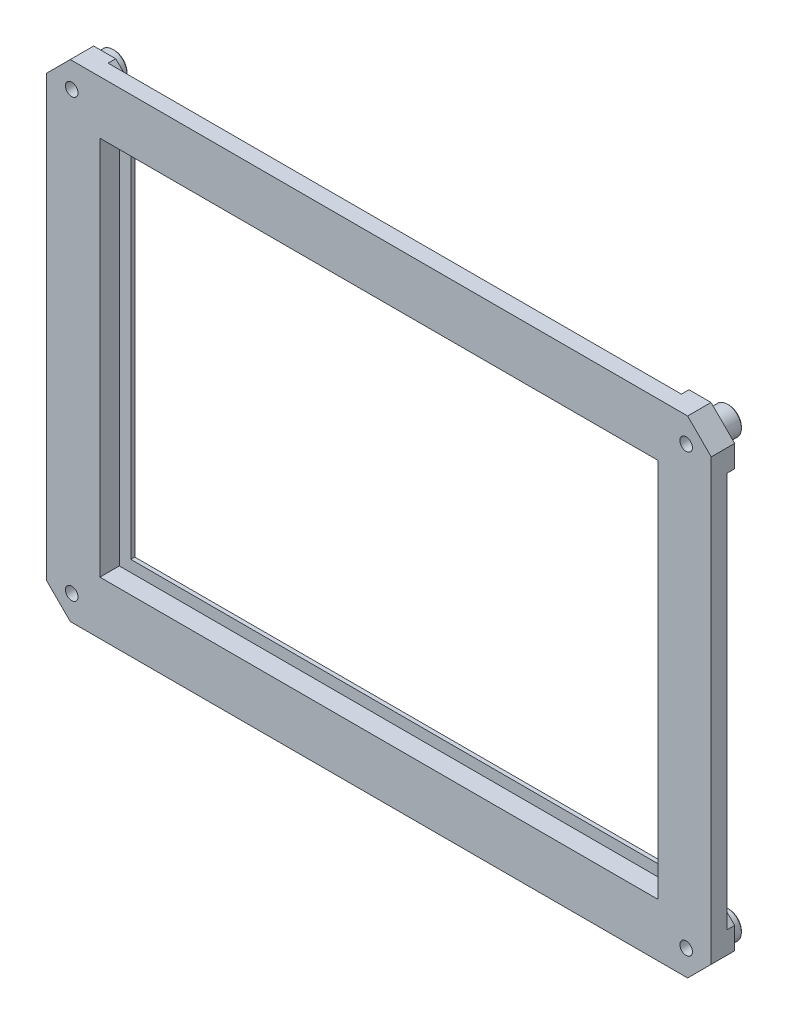
from build123d import *
from build123d.topology import SkipClean

# Parameters (mm, degrees)
BOSS_EXTRUDE1_DEPTH                      = 3
BOSS_EXTRUDE1_2_DEPTH                    = 3
BOSS_EXTRUDE1_3_DEPTH                    = 3
BOSS_EXTRUDE1_4_DEPTH                    = 3
BOSS_EXTRUDE1_5_DEPTH                    = 3
BOSS_EXTRUDE2_DEPTH                      = 6.15
CHAMFER1_SIZE                            = 2
BOSS_EXTRUDE3_DEPTH                      = 3
MIRROR1_DEPTH                            = 2
CHAMFER2_SIZE                            = 2
CUT_EXTRUDE2_DEPTH                       = 5.1
BOSS_EXTRUDE4_DEPTH                      = 5
CUT_EXTRUDE4_DEPTH                       = 202.98709309422546
MIRROR3_AT_THE_SECOND_PLANE_COPY_1_DEPTH = 5
MIRROR3_AT_THE_SECOND_PLANE_COPY_2_DEPTH = 202.98709309422546
CHAMFER3_SIZE                            = 0.3
CUT_EXTRUDE3_REACH                       = 210.139
BOSS_EXTRUDE5_DEPTH                      = 2.9


# Read off the part's stored shape, not the designer's step: Mirror1
with BuildPart() as part:
    # Sketch1 → Boss-Extrude1 (new body)
    with BuildSketch(Plane.XY):
        Polygon((-156.55, 3.799999999998499), (-156.55000000000007, 103.39999999999857), (-157.60000000000005, 103.39999999999857), (-157.60000000000002, 3.799999999998499), align=None)
    extrude(amount=-BOSS_EXTRUDE1_DEPTH)



with BuildPart() as body_2:
    # Sketch1 → Boss-Extrude1 2 (new body)
    with BuildSketch(Plane.XY):
        Polygon((-150.1, 109.84999999999852), (-3.800000000000109, 109.84999999999862), (-3.800000000000109, 110.89999999999861), (-150.10000000000008, 110.8999999999985), align=None)
    extrude(amount=-BOSS_EXTRUDE1_2_DEPTH)


with BuildPart() as body_3:
    # Sketch1 → Boss-Extrude1 3 (new body)
    with BuildSketch(Plane.XY):
        Polygon((2.6499999999999164, 103.39999999999867), (2.649999999999972, 3.7999999999985548), (3.6999999999999673, 3.7999999999985477), (3.6999999999999256, 103.39999999999867), align=None)
    extrude(amount=-BOSS_EXTRUDE1_3_DEPTH)


with BuildPart() as body_4:
    # Sketch1 → Boss-Extrude1 4 (new body)
    with BuildSketch(Plane.XY):
        Polygon((-3.800000000000109, -2.6500000000013597), (-150.09999999999997, -2.650000000001457), (-150.09999999999997, -3.700000000001438), (-3.8000000000000393, -3.7000000000013826), align=None)
    extrude(amount=-BOSS_EXTRUDE1_4_DEPTH)


with BuildPart() as body_5:
    # Sketch1 → Boss-Extrude1 5 (new body)
    with BuildSketch(Plane.XY):
        Polygon((-151.25, 2.6499999999985424), (-2.6500000000000274, 2.6499999999986117), (-2.650000000000083, 104.54999999999862), (-151.25000000000006, 104.54999999999853), align=None)
        Polygon((-150.20000000000005, 103.49999999999854), (-3.7000000000000783, 103.49999999999862), (-3.700000000000023, 3.699999999998614), (-150.2, 3.699999999998545), align=None, mode=Mode.SUBTRACT)
    extrude(amount=-BOSS_EXTRUDE1_5_DEPTH)


with BuildPart() as part_1:
    add(part.part)

    add(body_2.part)  # Boss-Extrude2 merges body 2

    add(body_3.part)  # Boss-Extrude2 merges body 3

    add(body_4.part)  # Boss-Extrude2 merges body 4

    add(body_5.part)  # Boss-Extrude2 merges body 5
    # Sketch2 → Boss-Extrude2 (add)
    with BuildSketch(Plane.XY):
        Polygon((-152.20000000000053, -10.287704918043708), (-157.98770491803333, -10.287704918043712), (-164.18770491803335, -4.087704918043719), (-164.18770491803335, 1.699999999989038), (-164.18770491803284, 105.49999999999856), (-164.18770491803284, 111.28770491803135), (-157.98770491803285, 117.48770491803134), (-152.20000000000007, 117.48770491803134), (-1.700000000000101, 117.48770491803131), (4.087704918032683, 117.48770491803131), (10.287704918032786, 111.28770491801959), (10.287704918032786, 105.49999999998684), (10.287704918032786, 1.6999999999890605), (10.287704918032786, -4.087704918043723), (4.087704918032788, -10.28770491804372), (-1.6999999999999682, -10.28770491804372), align=None)
        Polygon((-147.2, 6.699999999998546), (-6.700000000000024, 6.699999999998613), (-6.700000000000077, 100.49999999999862), (-147.20000000000005, 100.49999999999854), align=None, mode=Mode.SUBTRACT)
    extrude(amount=BOSS_EXTRUDE2_DEPTH)

    # Chamfer1
    chamfer1_edges = [part_1.edges().sort_by_distance(p)[0] for p in [
        (7.187704918032787, -7.187704918043722, 0),
        (10.287704918032786, 53.59999999998793, 0),
        (7.187704918032734, 114.38770491802545, 0),
        (-76.95000000000007, 117.48770491803133, 0),
        (-161.08770491803284, 114.38770491803135, 0),
        (-164.1877049180331, 53.59999999999382, 0),
        (-161.08770491803335, -7.187704918043716, 0),
        (-76.95000000000027, -10.287704918043715, 0),
    ]]
    chamfer(chamfer1_edges, length=CHAMFER1_SIZE)

    # Sketch4 → Boss-Extrude3 (add)
    with BuildSketch(Plane(origin=(0, 0, 0), x_dir=(-1, 0, 0), z_dir=(0, 0, -1))):
        Polygon((1.7000000000001219, 1.6999999999889326), (-10.287704918032786, 1.699999999988929), (-10.287704918032786, -4.087704918043727), (-4.087704918032788, -10.28770491804372), (1.7000000000001094, -10.28770491804372), align=None)
        Polygon((164.18770491803335, -4.087704918043719), (164.18770491803332, 1.6999999999889503), (152.20000000000041, 1.6999999999889481), (152.20000000000007, -10.287704918043712), (157.98770491803333, -10.287704918043712), align=None)
        Polygon((157.98770491803285, 117.48770491803134), (152.20000000000033, 117.48770491803134), (152.20000000000002, 105.4999999999988), (164.18770491803286, 105.4999999999988), (164.18770491803284, 111.28770491803135), align=None)
        Polygon((1.7000000000001085, 105.49999999999868), (1.7000000000001094, 117.48770491803131), (-4.087704918032671, 117.48770491803131), (-10.287704918032784, 111.28770491801959), (-10.287704918032786, 105.49999999999868), align=None)
    extrude(amount=-BOSS_EXTRUDE3_DEPTH)

    # Sketch5 → Loft1 section 0
    with BuildSketch(Plane(origin=(0, 0, 0), x_dir=(-1, 0, 0), z_dir=(0, 0, -1)), mode=Mode.PRIVATE) as loft1_s0:
        with BuildLine():
            Line((-10.287704918032686, 105.49999999999868), (-8.287704918032702, 103.49999999999875))
            Line((-8.287704918032702, 103.49999999999875), (-8.287704918032702, 105.49999999999868))
            Line((-8.287704918032702, 105.49999999999868), (-10.287704918032686, 105.49999999999868))
        make_face()
    loft([loft1_s0.sketch, Vertex(10.287704918, 105.5, 2)])

    # Sketch7 → Loft2 section 0
    with BuildSketch(Plane(origin=(0, 0, 0), x_dir=(-1, 0, 0), z_dir=(0, 0, -1)), mode=Mode.PRIVATE) as loft2_s0:
        with BuildLine():
            Line((1.700000000000108, 117.48770491803134), (3.7000000000000757, 115.48770491803135))
            Line((3.7000000000000757, 115.48770491803135), (1.7000000000001079, 115.48770491803133))
            Line((1.7000000000001079, 115.48770491803133), (1.700000000000108, 117.48770491803134))
        make_face()
    loft([Vertex(-1.7, 117.487704918, 2), loft2_s0.sketch])

    # Mirror1 outline → Mirror1 (add)
    with BuildSketch(Plane.XY):
        Polygon((-1.7, 1.7), (10.287704918, 1.7), (-1.7, 13.687704918), align=None)
        Polygon((-1.7, -10.287704918), (-1.7, 1.7), (-13.687704918, 1.7), align=None)
        Polygon((-152.2, -10.287704918), (-140.212295082, 1.7), (-152.2, 1.7), align=None)
        Polygon((-152.2, 105.5), (-140.212295082, 105.5), (-152.2, 117.487704918), align=None)
        Polygon((-164.187704918, 1.7), (-152.2, 1.7), (-152.2, 13.687704918), align=None)
        Polygon((-152.2, 93.512295082), (-152.2, 105.5), (-164.187704918, 105.5), align=None)
    extrude(amount=MIRROR1_DEPTH)

    # Chamfer2
    chamfer2_edges = [part_1.edges().sort_by_distance(p)[0] for p in [
        (-76.9500000000001, 110.89999999999856, 0),
        (-157.60000000000002, 53.59999999999854, 0),
        (3.6999999999999464, 53.59999999999861, 0),
        (-76.95, -3.7000000000014106, 0),
        (-150.20000000000002, 53.599999999998545, 0),
        (-76.95000000000006, 103.49999999999858, 0),
        (-3.700000000000051, 53.599999999998616, 0),
        (-76.95, 3.6999999999985795, 0),
    ]]
    chamfer(chamfer2_edges, length=CHAMFER2_SIZE)

    # Sketch11 → Cut-Extrude2 (cut)
    with BuildSketch(Plane.XY.offset(6.15)):
        Polygon((-150.2, 3.6999999999985453), (-3.700000000000023, 3.6999999999986137), (-3.7000000000000783, 103.49999999999862), (-150.20000000000005, 103.49999999999854), align=None)
    extrude(amount=-CUT_EXTRUDE2_DEPTH, mode=Mode.SUBTRACT)

    # Sketch12 → Boss-Extrude4 (add)
    with BuildSketch(Plane(origin=(0, 0, 0), x_dir=(-1, 0, 0), z_dir=(0, 0, -1))):
        with BuildLine():
            ThreePointArc((161.25000000000057, -3.700000000010667), (158.9967945281331, -0.32783970634446824), (155.01906024866963, -1.119060248679844))
            Line((155.01906024866966, -1.1190602486798047), (156.4332738110427, -2.5332738110529105))
            ThreePointArc((156.4332738110427, -2.533273811052915), (158.23142766340297, -2.175598771367012), (159.2500000000006, -3.700000000010667))
            ThreePointArc((159.2500000000006, -3.7000000000106676), (159.12440122864422, -4.331427663413119), (158.76672618895833, -4.866726188968555))
            Line((158.7667261889583, -4.866726188968588), (160.18093975133135, -6.280939751341704))
            ThreePointArc((160.18093975133138, -6.2809397513416645), (160.97216029366675, -5.096794528143313), (161.25000000000057, -3.700000000010668))
        make_face()
        with BuildLine():
            Line((156.4332738110427, -2.5332738110529105), (155.01906024866966, -1.1190602486798047))
            ThreePointArc((155.01906024866963, -1.119060248679844), (155.0190602486697, -6.280939751341531), (160.18093975133138, -6.2809397513416645))
            Line((160.18093975133135, -6.280939751341704), (158.7667261889583, -4.866726188968588))
            ThreePointArc((158.76672618895833, -4.866726188968555), (156.43327381104277, -4.866726188968477), (156.4332738110427, -2.533273811052915))
        make_face()
    boss_extrude4 = extrude(amount=BOSS_EXTRUDE4_DEPTH)

    # Sketch12<4> → Cut-Extrude4 (cut, through all)
    with SkipClean():  # the faces are left unmerged after this step: merging them gives an invalid solid
        with BuildSketch(Plane(origin=(0, 0, 0), x_dir=(-1, 0, 0), z_dir=(0, 0, -1))):
            with BuildLine():
                ThreePointArc((159.2500000000006, -3.700000000010667), (158.23142766340297, -2.175598771367012), (156.4332738110427, -2.533273811052915))
                Line((156.4332738110427, -2.5332738110529105), (158.7667261889583, -4.866726188968588))
                ThreePointArc((158.76672618895833, -4.866726188968555), (159.12440122864422, -4.331427663413119), (159.2500000000006, -3.7000000000106676))
            make_face()
            with BuildLine():
                Line((158.7667261889583, -4.866726188968588), (156.4332738110427, -2.5332738110529105))
                ThreePointArc((156.4332738110427, -2.533273811052915), (156.43327381104277, -4.866726188968477), (158.76672618895833, -4.866726188968555))
            make_face()
        cut_extrude4 = extrude(amount=-CUT_EXTRUDE4_DEPTH, mode=Mode.SUBTRACT)

    # Mirror3: Boss-Extrude4, Cut-Extrude4 across plane
    with SkipClean():  # the faces are left unmerged after this step: merging them gives an invalid solid
        add(boss_extrude4.mirror(Plane(origin=(-76.95, -4.412e-14, 0), x_dir=(0, 0, 1), z_dir=(1, 5.7e-16, 0))))
        add(cut_extrude4.mirror(Plane(origin=(-76.95, -4.412e-14, 0), x_dir=(0, 0, 1), z_dir=(1, 5.7e-16, 0))), mode=Mode.SUBTRACT)

    # Mirror3 at the second plane: Boss-Extrude4, Cut-Extrude4 across plane
    add(boss_extrude4.mirror(Plane(origin=(-2.846e-14, 53.59999999999862, 0), x_dir=(0, 0, 1), z_dir=(5.3e-16, -1, 0))))
    add(cut_extrude4.mirror(Plane(origin=(-2.846e-14, 53.59999999999862, 0), x_dir=(0, 0, 1), z_dir=(5.3e-16, -1, 0))), mode=Mode.SUBTRACT)

    # Mirror3 at the second plane copy 1 sketc → Mirror3 at the second plane copy 1 (add)
    with BuildSketch(Plane(origin=(-153.90000000000006, 107.19999999999717, 0), x_dir=(1, -8e-17, 0), z_dir=(0, 0, -1))):
        with BuildLine():
            ThreePointArc((161.25000000000057, -3.700000000010667), (158.9967945281331, -0.32783970634446824), (155.01906024866963, -1.119060248679844))
            Line((155.01906024866966, -1.1190602486798047), (156.4332738110427, -2.5332738110529105))
            ThreePointArc((156.4332738110427, -2.533273811052915), (158.23142766340297, -2.175598771367012), (159.2500000000006, -3.700000000010667))
            ThreePointArc((159.2500000000006, -3.7000000000106676), (159.12440122864422, -4.331427663413119), (158.76672618895833, -4.866726188968555))
            Line((158.7667261889583, -4.866726188968588), (160.18093975133135, -6.280939751341704))
            ThreePointArc((160.18093975133138, -6.2809397513416645), (160.97216029366675, -5.096794528143313), (161.25000000000057, -3.700000000010668))
        make_face()
        with BuildLine():
            Line((156.4332738110427, -2.5332738110529105), (155.01906024866966, -1.1190602486798047))
            ThreePointArc((155.01906024866963, -1.119060248679844), (155.0190602486697, -6.280939751341531), (160.18093975133138, -6.2809397513416645))
            Line((160.18093975133135, -6.280939751341704), (158.7667261889583, -4.866726188968588))
            ThreePointArc((158.76672618895833, -4.866726188968555), (156.43327381104277, -4.866726188968477), (156.4332738110427, -2.533273811052915))
        make_face()
    extrude(amount=MIRROR3_AT_THE_SECOND_PLANE_COPY_1_DEPTH)

    # Mirror3 at the second plane copy 2 sketc → Mirror3 at the second plane copy 2 (cut, through all)
    with BuildSketch(Plane(origin=(-153.90000000000006, 107.19999999999717, 0), x_dir=(1, -8e-17, 0), z_dir=(0, 0, -1))):
        with BuildLine():
            ThreePointArc((159.2500000000006, -3.700000000010667), (158.23142766340297, -2.175598771367012), (156.4332738110427, -2.533273811052915))
            Line((156.4332738110427, -2.5332738110529105), (158.7667261889583, -4.866726188968588))
            ThreePointArc((158.76672618895833, -4.866726188968555), (159.12440122864422, -4.331427663413119), (159.2500000000006, -3.7000000000106676))
        make_face()
        with BuildLine():
            Line((158.7667261889583, -4.866726188968588), (156.4332738110427, -2.5332738110529105))
            ThreePointArc((156.4332738110427, -2.533273811052915), (156.43327381104277, -4.866726188968477), (158.76672618895833, -4.866726188968555))
        make_face()
    extrude(amount=-MIRROR3_AT_THE_SECOND_PLANE_COPY_2_DEPTH, mode=Mode.SUBTRACT)

    # Chamfer3
    chamfer3_edges = [part_1.edges().sort_by_distance(p)[0] for p in [
        (-160.1809397513315, -6.280939751341554, -5),
        (-160.18093975133155, 113.48093975133862, -5),
        (6.2809397513314895, -6.28093975134146, -5),
        (6.280939751331427, 113.48093975133872, -5),
    ]]
    chamfer(chamfer3_edges, length=CHAMFER3_SIZE)

    # Cut-Extrude3: up to this face of the body (flat: up to its plane)
    cut_extrude3_end = Plane(part_1.part.faces().sort_by_distance((-76.95, 6.7, 0.525))[0])
    # Sketch13 → Cut-Extrude3 (cut, up to the picked face)
    with BuildSketch(Plane.XZ.offset(10.287704918043616), mode=Mode.PRIVATE) as cut_extrude3_sk1:
        with BuildLine():
            Line((-150.0999999999928, -67.22813782152119), (-150.0999999999928, -72.29000000000016))
            Line((-150.0999999999928, -72.29000000000016), (-3.7999999999928646, -72.29000000000016))
            Line((-3.7999999999928646, -72.29000000000016), (-3.7999999999928646, -67.22813782152119))
            Line((-3.7999999999928646, -67.22813782152119), (-6.199494936604516, -66.24854811567278))
            Line((-6.199494936604516, -66.24854811567278), (-6.199494936604544, -58.741451884327546))
            Line((-6.199494936604544, -58.741451884327546), (-3.7999999999928646, -57.761862178479156))
            Line((-3.7999999999928646, -57.761862178479156), (-3.7999999999928646, -49.700000000000145))
            Line((-3.7999999999928646, -49.700000000000145), (-75.49999999999261, -49.700000000000145))
            ThreePointArc((-75.49999999999261, -49.700000000000145), (-82.57106781185809, -46.77106781186563), (-85.49999999999261, -39.70000000000015))
            Line((-85.49999999999261, -39.70000000000015), (-85.49999999999261, -38.980000000000146))
            ThreePointArc((-85.49999999999261, -38.980000000000146), (-82.57106781185809, -31.908932188134674), (-75.49999999999261, -28.98000000000015))
            Line((-75.49999999999261, -28.98000000000015), (-58.849285999992624, -28.980000000000146))
            ThreePointArc((-58.849285999992624, -28.980000000000146), (-51.77821818812715, -26.05106781186562), (-48.849285999992624, -18.980000000000143))
            Line((-48.849285999992624, -18.980000000000143), (-48.849285999992624, -10.000000000000114))
            ThreePointArc((-48.849285999992624, -10.000000000000114), (-51.77821818812715, -2.9289321881346364), (-58.84928599999263, -1.1102e-13))
            Line((-58.84928599999263, -1.1102e-13), (-150.0999999999928, -1.1102e-13))
            Line((-150.0999999999928, -1.1102e-13), (-150.0999999999928, -7.231885425213205))
            ThreePointArc((-150.0999999999928, -7.231885425213205), (-149.02970711803647, -5.622570324451265), (-147.19999999999283, -5.000000000000131))
            Line((-147.19999999999283, -5.000000000000131), (-100.49999999999262, -5.0000000000001155))
            ThreePointArc((-100.49999999999262, -5.0000000000001155), (-93.42893218812715, -7.928932188134643), (-90.49999999999262, -15.000000000000117))
            Line((-90.49999999999262, -15.000000000000117), (-90.49999999999261, -51.70000000000015))
            ThreePointArc((-90.49999999999261, -51.70000000000015), (-91.37867965643296, -53.8213203435598), (-93.49999999999261, -54.70000000000015))
            Line((-93.49999999999261, -54.70000000000015), (-147.1999999999928, -54.70000000000015))
            ThreePointArc((-147.1999999999928, -54.70000000000015), (-149.02970711803647, -54.077429675549006), (-150.0999999999928, -52.468114574787016))
            Line((-150.0999999999928, -52.468114574787016), (-150.0999999999928, -57.761862178479156))
            Line((-150.0999999999928, -57.761862178479156), (-147.70050506338106, -58.74145188432755))
            Line((-147.70050506338106, -58.74145188432755), (-147.70050506338112, -66.24854811567279))
            Line((-147.70050506338112, -66.24854811567279), (-150.0999999999928, -67.22813782152119))
        make_face()
    cut_extrude3_tool1 = split(extrude(cut_extrude3_sk1.sketch, amount=-CUT_EXTRUDE3_REACH, mode=Mode.PRIVATE), bisect_by=cut_extrude3_end, keep=Keep.BOTH, mode=Mode.PRIVATE)
    add(cut_extrude3_tool1.solids().sort_by(Axis((-150.02498, -10.287705, -55.370637), (-6e-16, 1, 0)))[0], mode=Mode.SUBTRACT)

    # Sketch14 → Boss-Extrude5 (add)
    with BuildSketch(Plane(origin=(0, 0, 0), x_dir=(-1, 0, 0), z_dir=(0, 0, -1))):
        Polygon((58.99928599999263, -2.5013735128958055), (58.99928599999263, 2.4999999999986255), (151.1, 2.4999999999986255), (151.1, -3.3486137939698013), align=None)
    extrude(amount=BOSS_EXTRUDE5_DEPTH)


solid = part_1.part
